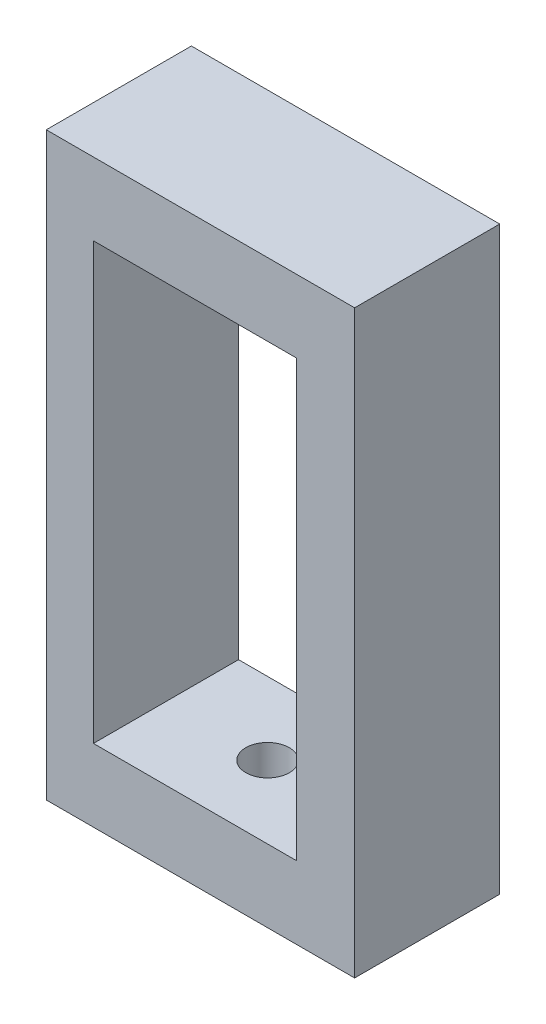
from build123d import *

# Parameters (mm, degrees)
SKETCH1_W           = 21.25
SKETCH1_H           = 40
SKETCH1_W_2         = 14
SKETCH1_H_2         = 30
BOSS_EXTRUDE1_DEPTH = 10
SKETCH2_R           = 1.5
CUT_EXTRUDE1_DEPTH  = 15


with BuildPart() as part:
    # Sketch1 → Boss-Extrude1 (new body)
    with BuildSketch(Plane.XY):
        with Locations((11.375, 20)):
            Rectangle(SKETCH1_W, SKETCH1_H)
        with Locations((11, 20)):
            Rectangle(SKETCH1_W_2, SKETCH1_H_2, mode=Mode.SUBTRACT)
    extrude(amount=BOSS_EXTRUDE1_DEPTH)

    # Sketch2 → Cut-Extrude1 (cut, symmetric)
    with BuildSketch(Plane(origin=(0, 0, 0), x_dir=(1, 0, 0), z_dir=(0, 1, 0))):
        with Locations((11, -5)):
            Circle(SKETCH2_R)
    extrude(amount=CUT_EXTRUDE1_DEPTH, both=True, mode=Mode.SUBTRACT)


solid = part.part
